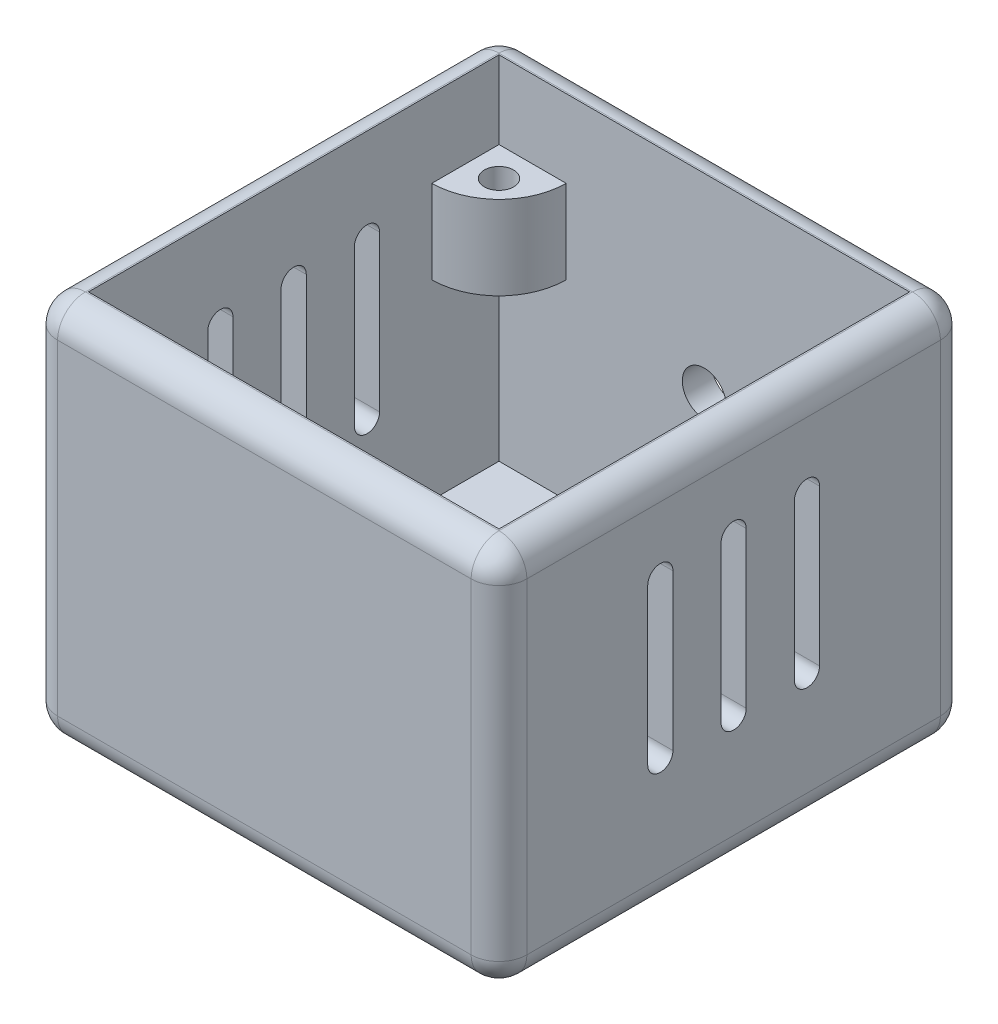
from build123d import *

# Parameters (mm, degrees)
SKETCH_1_W           = 32
SKETCH_1_H           = 32
EXTRUDE_1_DEPTH      = 26
SHELL_1_T            = -2
FILLET_2_R           = 1.9
SKETCH_6_R           = 1
EXTRUDE_3_DEPTH      = 5.7
SKETCH_12_R          = 1.5
CUT_EXTRUDE_5_DEPTH  = 2
SKETCH_13_W          = 3
SKETCH_13_H          = 1.1
CUT_EXTRUDE_7_DEPTH  = 0.8
SKETCH_15_W          = 17.5
SKETCH_15_H          = 1.379565451
CUT_EXTRUDE_14_DEPTH = 0.3
CUT_EXTRUDE_13_DEPTH = 2
SKETCH_17_W          = 10.9
SKETCH_17_H          = 6.2
SKETCH_17_W_2        = 8.9
SKETCH_17_H_2        = 4.2
EXTRUDE_4_DEPTH      = 2.2
SKETCH_19_W          = 8.9
SKETCH_19_H          = 4.2
CUT_EXTRUDE_11_DEPTH = 2
CUT_EXTRUDE_12_DEPTH = 32


with BuildPart() as part:
    # 草图1 → 凸台-拉伸1 (new body)
    with BuildSketch(Plane(origin=(0, 0, 0), x_dir=(1, 0, 0), z_dir=(0, 1, 0))):
        Rectangle(SKETCH_1_W, SKETCH_1_H)
    extrude(amount=EXTRUDE_1_DEPTH)

    # 抽壳1
    shell_1_openings = [part.faces().sort_by_distance(p)[0] for p in [
        (0, 26, 0),
    ]]
    offset(amount=SHELL_1_T, openings=shell_1_openings, kind=Kind.INTERSECTION)

    # 圆角2
    fillet_2_edges = [part.edges().sort_by_distance(p)[0] for p in [
        (-16, 26, 0),
        (0, 26, -16),
        (-16, 13, -16),
        (0, 0, -16),
        (-16, 0, 0),
        (16, 26, 0),
        (16, 13, -16),
        (16, 0, 0),
        (-16, 13, 16),
        (0, 26, 16),
        (16, 13, 16),
        (0, 0, 16),
    ]]
    fillet(fillet_2_edges, radius=FILLET_2_R)

    # 草图6 → 凸台-拉伸3 (add)
    # profile 1 of 4: a face of its own
    with BuildSketch(Plane(origin=(0, 20.7, 0), x_dir=(1, 0, 0), z_dir=(0, 1, 0))):
        with BuildLine():
            Line((-14, 14), (-9.422209932, 14))
            ThreePointArc((-9.422209932, 14), (-10.7630136, 10.7630136), (-14, 9.422209932))
            Line((-14, 9.422209932), (-14, 14))
        make_face()
        with Locations((-12, 12)):
            Circle(SKETCH_6_R, mode=Mode.SUBTRACT)
    # profile 2 of 4: a face of its own
    with BuildSketch(Plane(origin=(0, 20.7, 0), x_dir=(1, 0, 0), z_dir=(0, 1, 0))):
        with BuildLine():
            Line((14, 14), (14, 9.458479825))
            ThreePointArc((14, 9.458479825), (10.788660287, 10.788660287), (9.458479825, 14))
            Line((9.458479825, 14), (14, 14))
        make_face()
        with Locations((12, 12)):
            Circle(SKETCH_6_R, mode=Mode.SUBTRACT)
    # profile 3 of 4: a face of its own
    with BuildSketch(Plane(origin=(0, 20.7, 0), x_dir=(1, 0, 0), z_dir=(0, 1, 0))):
        with BuildLine():
            Line((-14, -9.417689546), (-14, -14))
            Line((-14, -14), (-9.417689546, -14))
            ThreePointArc((-9.417689546, -14), (-10.759817205, -10.759817205), (-14, -9.417689546))
        make_face()
        with Locations((-12, -12)):
            Circle(SKETCH_6_R, mode=Mode.SUBTRACT)
    # profile 4 of 4: a face of its own
    with BuildSketch(Plane(origin=(0, 20.7, 0), x_dir=(1, 0, 0), z_dir=(0, 1, 0))):
        with BuildLine():
            Line((9.370725518, -14), (14, -14))
            Line((14, -14), (14, -9.370725518))
            ThreePointArc((14, -9.370725518), (10.726608622, -10.726608622), (9.370725518, -14))
        make_face()
        with Locations((12, -12)):
            Circle(SKETCH_6_R, mode=Mode.SUBTRACT)
    extrude(amount=-EXTRUDE_3_DEPTH)

    # 草图12 → 切除-拉伸5 (cut)
    with BuildSketch(Plane(origin=(0, 0, -16), x_dir=(-1, 0, 0), z_dir=(0, 0, -1))):
        with Locations((0, 13)):
            Circle(SKETCH_12_R)
    extrude(amount=-CUT_EXTRUDE_5_DEPTH, mode=Mode.SUBTRACT)

    # 草图13 → 切除-拉伸7 (cut)
    with BuildSketch(Plane.ZY.offset(-14)):
        with Locations((-4, 2.55)):
            Rectangle(SKETCH_13_W, SKETCH_13_H)
        with Locations((10.5, 2.55)):
            Rectangle(SKETCH_13_W, SKETCH_13_H)
    extrude(amount=-CUT_EXTRUDE_7_DEPTH, mode=Mode.SUBTRACT)

    # 草图15 → 切除-拉伸14 (cut)
    with BuildSketch(Plane(origin=(-14, 0, 0), x_dir=(0, 0, -1), z_dir=(1, 0, 0))):
        with Locations((-3.25, 2.689782726)):
            Rectangle(SKETCH_15_W, SKETCH_15_H)
    extrude(amount=-CUT_EXTRUDE_14_DEPTH, mode=Mode.SUBTRACT)

    # 草图16 → 切除-拉伸13 (cut)
    with BuildSketch(Plane.ZY.offset(16)):
        with BuildLine():
            Line((0.05, 6.75), (6.45, 6.75))
            ThreePointArc((6.45, 6.75), (8.2, 5), (6.45, 3.25))
            Line((6.45, 3.25), (0.05, 3.25))
            ThreePointArc((0.05, 3.25), (-1.7, 5), (0.05, 6.75))
        make_face()
    extrude(amount=-CUT_EXTRUDE_13_DEPTH, mode=Mode.SUBTRACT)

    # 草图17 → 凸台-拉伸4 (add)
    with BuildSketch(Plane(origin=(0, 2, 0), x_dir=(1, 0, 0), z_dir=(0, 1, 0))):
        with Locations((-0.05, 10.9)):
            Rectangle(SKETCH_17_W, SKETCH_17_H)
        with Locations((-0.05, 10.9)):
            Rectangle(SKETCH_17_W_2, SKETCH_17_H_2, mode=Mode.SUBTRACT)
    extrude(amount=EXTRUDE_4_DEPTH)

    # 草图19 → 切除-拉伸11 (cut)
    with BuildSketch(Plane.XZ):
        with Locations((-0.05, -10.9)):
            Rectangle(SKETCH_19_W, SKETCH_19_H)
    extrude(amount=-CUT_EXTRUDE_11_DEPTH, mode=Mode.SUBTRACT)

    # 草图20 → 切除-拉伸12 (cut)
    with BuildSketch(Plane.ZY.offset(16)):
        with BuildLine():
            Line((0.858763674, 19.601706642), (0.858763674, 8.984264858))
            ThreePointArc((0.858763674, 8.984264858), (0, 8.125501184), (-0.858763674, 8.984264858))
            Line((-0.858763674, 8.984264858), (-0.858763674, 19.601706642))
            ThreePointArc((-0.858763674, 19.601706642), (0, 20.460470315), (0.858763674, 19.601706642))
        make_face()
        with BuildLine():
            Line((5.858763674, 19.601706642), (5.858763674, 8.984264858))
            ThreePointArc((5.858763674, 8.984264858), (5, 8.125501184), (4.141236326, 8.984264858))
            Line((4.141236326, 8.984264858), (4.141236326, 19.601706642))
            ThreePointArc((4.141236326, 19.601706642), (5, 20.460470315), (5.858763674, 19.601706642))
        make_face()
        with BuildLine():
            Line((-4.141236326, 19.601706642), (-4.141236326, 8.984264858))
            ThreePointArc((-4.141236326, 8.984264858), (-5, 8.125501184), (-5.858763674, 8.984264858))
            Line((-5.858763674, 8.984264858), (-5.858763674, 19.601706642))
            ThreePointArc((-5.858763674, 19.601706642), (-5, 20.460470315), (-4.141236326, 19.601706642))
        make_face()
    extrude(amount=-CUT_EXTRUDE_12_DEPTH, mode=Mode.SUBTRACT)


solid = part.part
